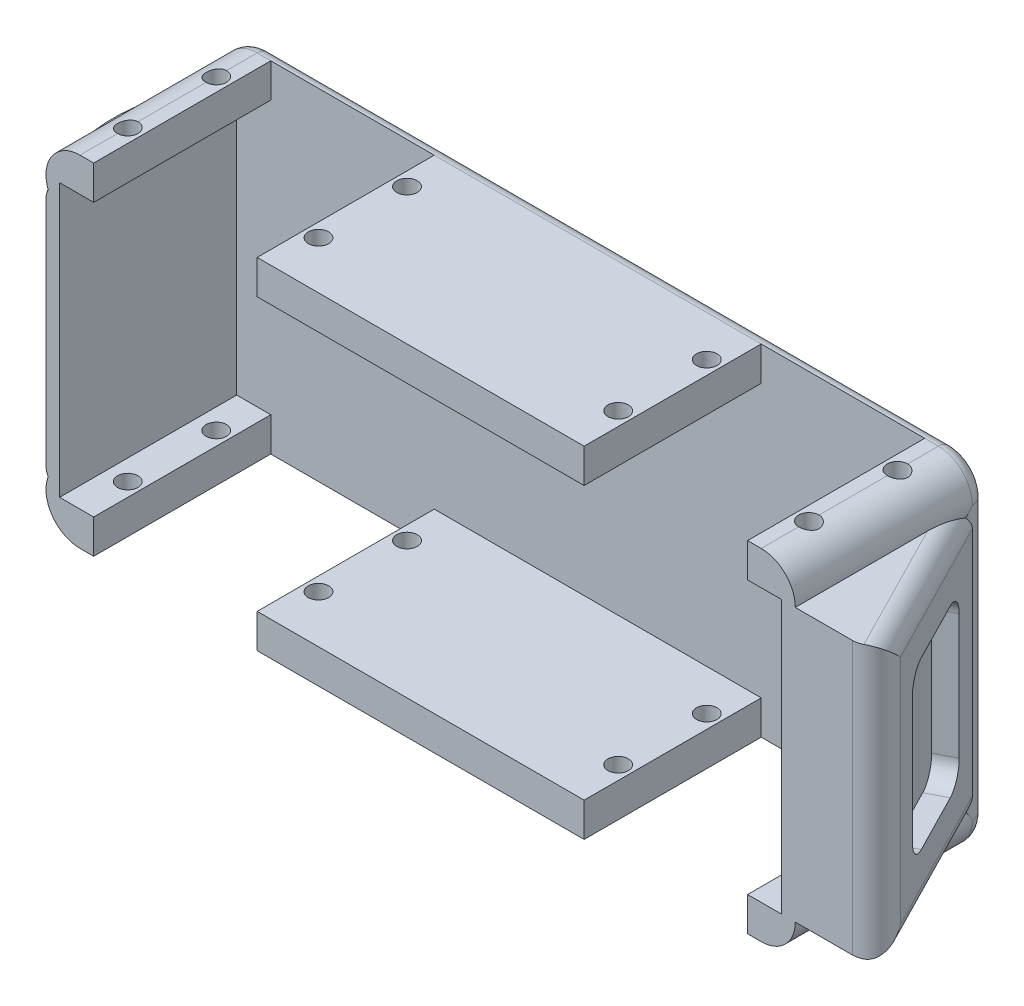
from build123d import *

# Parameters (mm, degrees)
BOSS_EXTRUDE1_DEPTH                          = 28
SKETCH2_W                                    = 106.00000000000003
SKETCH2_H                                    = 40
CUT_EXTRUDE1_DEPTH                           = 26
FILLET1_R                                    = 2
FILLET2_R                                    = 5
SKETCH3_W                                    = 23.999999999999993
SKETCH3_H                                    = 5.0000000000000036
CUT_EXTRUDE3_DEPTH                           = 26
SKETCH4_R                                    = 1.500000000000004
SKETCH4_R_2                                  = 1.5000000000000007
CUT_EXTRUDE4_DEPTH                           = 15
LPATTERN1_COUNT                              = 2
LPATTERN1_PITCH                              = 13
MIRROR4_COPY_1_SKETCH_R                      = 1.500000000000004
MIRROR4_COPY_1_SKETCH_R_2                    = 1.5000000000000007
MIRROR4_COPY_1_DEPTH                         = 15
MIRROR4_AT_THE_SECOND_PLANE_COPY_1_SKETC_R   = 1.500000000000004
MIRROR4_AT_THE_SECOND_PLANE_COPY_1_SKETC_R_2 = 1.5000000000000007
MIRROR4_AT_THE_SECOND_PLANE_COPY_1_DEPTH     = 15
MIRROR4_AT_THE_SECOND_PLANE_COPY_2_SKETC_W   = 23.999999999999993
MIRROR4_AT_THE_SECOND_PLANE_COPY_2_SKETC_H   = 5.0000000000000036
MIRROR4_AT_THE_SECOND_PLANE_COPY_2_DEPTH     = 26
MIRROR4_AT_THE_SECOND_PLANE_COPY_3_SKETC_R   = 1.500000000000004
MIRROR4_AT_THE_SECOND_PLANE_COPY_3_SKETC_R_2 = 1.5000000000000007
MIRROR4_AT_THE_SECOND_PLANE_COPY_3_DEPTH     = 15
MIRROR4_AT_THE_SECOND_PLANE_COPY_4_SKETC_R   = 1.500000000000004
MIRROR4_AT_THE_SECOND_PLANE_COPY_4_SKETC_R_2 = 1.5000000000000007
MIRROR4_AT_THE_SECOND_PLANE_COPY_4_DEPTH     = 15
BOSS_EXTRUDE2_DEPTH                          = 20
BOSS_EXTRUDE2_DEPTH_BACK                     = 20
FILLET3_R                                    = 3
FILLET4_R                                    = 3
CUT_EXTRUDE5_DEPTH                           = 3


with BuildPart() as part:
    # Sketch1 → Boss-Extrude1 (new body)
    with BuildSketch(Plane.XY):
        Polygon((-55.00000000000001, 25), (54.99999999999999, 25), (54.99999999999999, -25), (-54.99999999999999, -25), align=None)
    extrude(amount=BOSS_EXTRUDE1_DEPTH)

    # Sketch2 → Cut-Extrude1 (cut)
    with BuildSketch(Plane.XY.offset(28)):
        Rectangle(SKETCH2_W, SKETCH2_H)
    extrude(amount=-CUT_EXTRUDE1_DEPTH, mode=Mode.SUBTRACT)

    # Fillet1
    fillet1_edges = [part.edges().sort_by_distance(p)[0] for p in [
        (0, -25, 0),
        (-55, 0, 0),
        (-7.11e-15, 25, 0),
        (54.99999999999999, 0, 0),
    ]]
    fillet(fillet1_edges, radius=FILLET1_R)

    # Fillet2
    # the kernel refuses this fillet: 5 mm, written as the material it takes off along each edge
    with BuildSketch(Plane(origin=(-49.99999999999999, -20, 0), x_dir=(0, -1, 0), z_dir=(1, 0, 0))) as fillet2_piece_1:
        with BuildLine():
            CenterArc((3, -2), 2, 0, 90)
            Line((5, -2), (5, 0))
            Line((5, 0), (3, 0))
        make_face()
    revolve(axis=Axis((-49.99999999999999, -20, 0), (0, 0, -1)), revolution_arc=89.99999999999999, mode=Mode.SUBTRACT)
    with BuildSketch(Plane(origin=(-50.00000000000001, 20, 0), x_dir=(-1, -2.8e-16, 0), z_dir=(2.8e-16, -1, 0))) as fillet2_piece_2:
        with BuildLine():
            CenterArc((3, -2), 2, 0, 90)
            Line((5, -2), (5, 0))
            Line((5, 0), (3, 0))
        make_face()
    revolve(axis=Axis((-50.00000000000001, 20, 0), (0, 0, -1)), revolution_arc=90.00000000000003, mode=Mode.SUBTRACT)
    with BuildSketch(Plane(origin=(49.99999999999999, -20, 0), x_dir=(1, 0, 0), z_dir=(0, 1, 0))) as fillet2_piece_3:
        with BuildLine():
            CenterArc((3, -2), 2, 0, 90)
            Line((5, -2), (5, 0))
            Line((5, 0), (3, 0))
        make_face()
    revolve(axis=Axis((49.99999999999999, -20, 0), (0, 0, -1)), revolution_arc=90, mode=Mode.SUBTRACT)
    with BuildSketch(Plane(origin=(49.99999999999999, 20, 0), x_dir=(0, 1, 0), z_dir=(-1, 0, 0))) as fillet2_piece_4:
        with BuildLine():
            CenterArc((3, -2), 2, 0, 90)
            Line((5, -2), (5, 0))
            Line((5, 0), (3, 0))
        make_face()
    revolve(axis=Axis((49.99999999999999, 20, 0), (0, 0, -1)), revolution_arc=90, mode=Mode.SUBTRACT)
    with BuildSketch(Plane(origin=(54.99999999999999, -25, -6.7e-16), x_dir=(0, 1, 0), z_dir=(0, 0, 1)), Plane(origin=(54.99999999999999, 25, -4.4e-16), x_dir=(-1, 0, 0), z_dir=(0, 0, 1))) as fillet2_piece_5:
        with BuildLine():
            CenterArc((FILLET2_R, FILLET2_R), FILLET2_R, 180, 90)
            Line((0, FILLET2_R), (0, 0))
            Line((0, 0), (FILLET2_R, 0))
        make_face()
    extrude(amount=40.5, mode=Mode.SUBTRACT)
    with BuildSketch(Plane(origin=(-54.99999999999999, -25, -6.7e-16), x_dir=(0, 1, 0), z_dir=(0, 0, 1)), Plane(origin=(-55.00000000000001, 25, -4.4e-16), x_dir=(1, 0, 0), z_dir=(0, 0, 1))) as fillet2_piece_6:
        with BuildLine():
            CenterArc((FILLET2_R, -FILLET2_R), FILLET2_R, 90, 90)
            Line((0, -FILLET2_R), (0, 0))
            Line((0, 0), (FILLET2_R, 0))
        make_face()
    extrude(amount=40.5, mode=Mode.SUBTRACT)

    # Sketch3 → Cut-Extrude3 (cut)
    with BuildSketch(Plane.XY.offset(28)):
        with Locations((-36, 22.5)):
            Rectangle(SKETCH3_W, SKETCH3_H)
    cut_extrude3 = extrude(amount=-CUT_EXTRUDE3_DEPTH, mode=Mode.SUBTRACT)

    # Sketch4 → Cut-Extrude4 (cut)
    with BuildSketch(Plane(origin=(0, 25, 0), x_dir=(1, 0, 0), z_dir=(0, 1, 0))):
        with Locations(Location((-50, -8, 0), (0, 0, 270))):
            Circle(SKETCH4_R)
        with Locations(Location((-22.000000000000007, -7.9999999999999964, 0), (0, 0, 270))):
            Circle(SKETCH4_R_2)
    cut_extrude4 = extrude(amount=-CUT_EXTRUDE4_DEPTH, mode=Mode.SUBTRACT)

    # LPattern1: Cut-Extrude4 ×2
    with Locations(*[(0, 0, i * LPATTERN1_PITCH) for i in range(1, LPATTERN1_COUNT)]):
        add(cut_extrude4, mode=Mode.SUBTRACT)

    # Mirror4: Cut-Extrude3, Cut-Extrude4 across plane
    add(cut_extrude3.mirror(Plane(origin=(0, 0, 0), x_dir=(0, 0, 1), z_dir=(1, 0, 0))), mode=Mode.SUBTRACT)
    add(cut_extrude4.mirror(Plane(origin=(0, 0, 0), x_dir=(0, 0, 1), z_dir=(1, 0, 0))), mode=Mode.SUBTRACT)

    # Mirror4 copy 1 sketch → Mirror4 copy 1 (cut)
    with BuildSketch(Plane(origin=(0, 25, 13), x_dir=(-1, 0, 0), z_dir=(0, 1, 0))):
        with Locations((-50, 8)):
            Circle(MIRROR4_COPY_1_SKETCH_R)
        with Locations((-22.000000000000007, 7.9999999999999964)):
            Circle(MIRROR4_COPY_1_SKETCH_R_2)
    extrude(amount=-MIRROR4_COPY_1_DEPTH, mode=Mode.SUBTRACT)

    # Mirror4 at the second plane: Cut-Extrude3, Cut-Extrude4 across plane
    add(cut_extrude3.mirror(Plane.ZX), mode=Mode.SUBTRACT)
    add(cut_extrude4.mirror(Plane.ZX), mode=Mode.SUBTRACT)

    # Mirror4 at the second plane copy 1 sketc → Mirror4 at the second plane copy 1 (cut)
    with BuildSketch(Plane(origin=(0, -25, 13), x_dir=(1, 0, 0), z_dir=(0, -1, 0))):
        with Locations((-50, 8)):
            Circle(MIRROR4_AT_THE_SECOND_PLANE_COPY_1_SKETC_R)
        with Locations((-22.000000000000007, 7.9999999999999964)):
            Circle(MIRROR4_AT_THE_SECOND_PLANE_COPY_1_SKETC_R_2)
    extrude(amount=-MIRROR4_AT_THE_SECOND_PLANE_COPY_1_DEPTH, mode=Mode.SUBTRACT)

    # Mirror4 at the second plane copy 2 sketc → Mirror4 at the second plane copy 2 (cut)
    with BuildSketch(Plane(origin=(0, 0, 28), x_dir=(-1, 0, 0), z_dir=(0, 0, 1))):
        with Locations((-36, 22.5)):
            Rectangle(MIRROR4_AT_THE_SECOND_PLANE_COPY_2_SKETC_W, MIRROR4_AT_THE_SECOND_PLANE_COPY_2_SKETC_H)
    extrude(amount=-MIRROR4_AT_THE_SECOND_PLANE_COPY_2_DEPTH, mode=Mode.SUBTRACT)

    # Mirror4 at the second plane copy 3 sketc → Mirror4 at the second plane copy 3 (cut)
    with BuildSketch(Plane(origin=(0, -25, 0), x_dir=(-1, 0, 0), z_dir=(0, -1, 0))):
        with Locations(Location((-50, -8, 0), (0, 0, 270))):
            Circle(MIRROR4_AT_THE_SECOND_PLANE_COPY_3_SKETC_R)
        with Locations(Location((-22.000000000000007, -7.9999999999999964, 0), (0, 0, 270))):
            Circle(MIRROR4_AT_THE_SECOND_PLANE_COPY_3_SKETC_R_2)
    extrude(amount=-MIRROR4_AT_THE_SECOND_PLANE_COPY_3_DEPTH, mode=Mode.SUBTRACT)

    # Mirror4 at the second plane copy 4 sketc → Mirror4 at the second plane copy 4 (cut)
    with BuildSketch(Plane(origin=(0, -25, 13), x_dir=(-1, 0, 0), z_dir=(0, -1, 0))):
        with Locations(Location((-50, -8, 0), (0, 0, 270))):
            Circle(MIRROR4_AT_THE_SECOND_PLANE_COPY_4_SKETC_R)
        with Locations(Location((-22.000000000000007, -7.9999999999999964, 0), (0, 0, 270))):
            Circle(MIRROR4_AT_THE_SECOND_PLANE_COPY_4_SKETC_R_2)
    extrude(amount=-MIRROR4_AT_THE_SECOND_PLANE_COPY_4_DEPTH, mode=Mode.SUBTRACT)

    # Sketch5 → Boss-Extrude2 (add, two sides: drawn at the far end of the back side and taken through both)
    with BuildSketch(Plane(origin=(0, 0, 0), x_dir=(1, 0, 0), z_dir=(0, 1, 0)).offset(-BOSS_EXTRUDE2_DEPTH_BACK)):
        Polygon((54.99999999999999, -1.9999999999999982), (68.27804634105689, -28), (54.99999999999999, -28), align=None)
        with BuildLine():
            Line((-55.00000000000001, -1.9999999999999982), (-55.00000000000001, -28))
            ThreePointArc((-55.00000000000001, -28), (-59.03952483504219, -14.999999999999996), (-55.00000000000001, -1.9999999999999982))
        make_face()
    extrude(amount=BOSS_EXTRUDE2_DEPTH + BOSS_EXTRUDE2_DEPTH_BACK)

    # Fillet3
    # the kernel refuses this fillet: 3 mm, written as the material it takes off along each edge
    with BuildSketch(Plane(origin=(-36.1014605254329, -20, 15), x_dir=(-0.5981604498568248, 0, 0.8013763636563541), z_dir=(0.8013763636563541, 0, 0.5981604498568248))) as fillet3_piece_1_section:
        with BuildLine():
            CenterArc((22.93806430960929 - FILLET3_R, -FILLET3_R), FILLET3_R, 0, 90)
            Line((22.93806430960929 - FILLET3_R, 0), (22.93806430960929, 0))
            Line((22.93806430960929, 0), (22.93806430960929, -FILLET3_R))
        make_face()
    fillet3_piece_1 = revolve(axis=Axis((-36.1014605254329, -20, 15), (0, -1, 0)), revolution_arc=106.52347426926733, mode=Mode.PRIVATE)
    fillet3_piece_1 = fillet3_piece_1 - Plane(origin=(-50, -20, 15.08905833687256), x_dir=(0, 1, 0), z_dir=(0, 0, -1)) * Cylinder(5, 92, mode=Mode.PRIVATE)
    fillet3_piece_1 = fillet3_piece_1 - Plane(origin=(-53, -19.147031230500815, 1.9999999999999996), x_dir=(-1, -2.8e-16, 0), z_dir=(-2.8e-16, 1, 0)) * Cylinder(2, 92, mode=Mode.PRIVATE)
    add(fillet3_piece_1, mode=Mode.SUBTRACT)
    with BuildSketch(Plane(origin=(-36.1014605254329, 20, 15), x_dir=(-0.5981604498568248, 0, 0.8013763636563541), z_dir=(0.8013763636563541, 0, 0.5981604498568248))) as fillet3_piece_2_section:
        with BuildLine():
            CenterArc((22.93806430960929 - FILLET3_R, FILLET3_R), FILLET3_R, 270, 90)
            Line((22.93806430960929 - FILLET3_R, 0), (22.93806430960929, 0))
            Line((22.93806430960929, 0), (22.93806430960929, FILLET3_R))
        make_face()
    fillet3_piece_2 = revolve(axis=Axis((-36.1014605254329, 20, 15), (0, -1, 0)), revolution_arc=106.52347426926733, mode=Mode.PRIVATE)
    fillet3_piece_2 = fillet3_piece_2 - Plane(origin=(-50, 20, 15.08905833686733), x_dir=(1, 0, 0), z_dir=(0, 0, -1)) * Cylinder(5, 92, mode=Mode.PRIVATE)
    fillet3_piece_2 = fillet3_piece_2 - Plane(origin=(-53.000000000000014, 19.147031229108137, 1.9999999999999996), x_dir=(-1, -2.8e-16, 0), z_dir=(-2.8e-16, 1, 0)) * Cylinder(2, 92, mode=Mode.PRIVATE)
    add(fillet3_piece_2, mode=Mode.SUBTRACT)

    # Fillet4
    # the kernel refuses this fillet: 3 mm, written as the material it takes off along each edge
    with BuildSketch(Plane(origin=(51.58887574553635, -20, -4.6793885439170175), x_dir=(-0.8905851391889352, 0, 0.45481656726181896), z_dir=(0.45481656726181896, 0, 0.8905851391889353))) as fillet4_piece_1_section:
        with BuildLine():
            CenterArc((FILLET4_R, -FILLET4_R), FILLET4_R, 90, 90)
            Line((2.83e-15, -FILLET4_R), (0, 0))
            Line((0, 0), (FILLET4_R, 0))
        make_face()
    fillet4_piece_1 = extrude(amount=44.194289075695174, mode=Mode.PRIVATE)
    fillet4_piece_1 = fillet4_piece_1 - Plane(origin=(50, -20, 15.678457101649087), x_dir=(0, 1, 0), z_dir=(0, 0, -1)) * Cylinder(5, 101, mode=Mode.PRIVATE)
    fillet4_piece_1 = fillet4_piece_1 - Plane(origin=(52.99999999999999, -19.312649305850513, 1.9999999999999996), x_dir=(1, 0, 0), z_dir=(0, -1, 0)) * Cylinder(2, 101, mode=Mode.PRIVATE)
    add(fillet4_piece_1, mode=Mode.SUBTRACT)
    with BuildSketch(Plane(origin=(68.27804634105689, 32.2516352163708, 28), x_dir=(-1, 0, 0), z_dir=(0, -1, 0))) as fillet4_piece_2:
        with BuildLine():
            CenterArc((FILLET4_R * 1.63355136218, FILLET4_R), FILLET4_R, 152.9468675340144, 117.05313246598561)
            Line((FILLET4_R * 0.742966222994, FILLET4_R * 1.45481656726), (0, 0))
            Line((0, 0), (FILLET4_R * 1.63355136218, 0))
        make_face()
    extrude(amount=64.5032704327416, mode=Mode.SUBTRACT)
    with BuildSketch(Plane(origin=(51.58887574553635, 20, -4.679388543917019), x_dir=(-4.8e-16, -1, 2.4e-16), z_dir=(0.45481656726181896, 0, 0.8905851391889353))) as fillet4_piece_3_section:
        with BuildLine():
            CenterArc((FILLET4_R, -FILLET4_R), FILLET4_R, 90.00000000000004, 90)
            Line((1.62e-15, -FILLET4_R), (0, 0))
            Line((0, 0), (FILLET4_R, 0))
        make_face()
    fillet4_piece_3 = extrude(amount=44.194289075695174, mode=Mode.PRIVATE)
    fillet4_piece_3 = fillet4_piece_3 - Plane(origin=(52.99999999999999, 19.312649295063746, 1.9999999999999996), x_dir=(1, 0, 0), z_dir=(0, -1, 0)) * Cylinder(2, 101, mode=Mode.PRIVATE)
    fillet4_piece_3 = fillet4_piece_3 - Plane(origin=(50, 20, 15.67845699140253), x_dir=(-1, 0, 0), z_dir=(0, 0, -1)) * Cylinder(5, 101, mode=Mode.PRIVATE)
    add(fillet4_piece_3, mode=Mode.SUBTRACT)

    # Sketch6 → Cut-Extrude5 (cut)
    with BuildSketch(Plane(origin=(42.81269820620907, 0, -21.86419195260489), x_dir=(-0.45481656726181885, 0, -0.8905851391889354), z_dir=(0.8905851391889354, 0, -0.45481656726181885))):
        with BuildLine():
            Line((-44.028294567880685, 12.191750605269407), (-34.243805861609616, 12.191750605269407))
            ThreePointArc((-34.243805861609616, 12.191750605269407), (-32.12248551804998, 11.31307094882905), (-31.24380586160961, 9.191750605269409))
            Line((-31.24380586160961, 9.191750605269409), (-31.24380586160961, -9.191750605269409))
            ThreePointArc((-31.24380586160961, -9.191750605269409), (-32.12248551804997, -11.313070948829052), (-34.243805861609616, -12.19175060526941))
            Line((-34.243805861609616, -12.19175060526941), (-44.028294567880685, -12.19175060526941))
            ThreePointArc((-44.028294567880685, -12.19175060526941), (-46.149614911440324, -11.313070948829047), (-47.02829456788068, -9.191750605269409))
            Line((-47.02829456788068, -9.191750605269409), (-47.02829456788068, 9.191750605269409))
            ThreePointArc((-47.02829456788068, 9.191750605269409), (-46.149614911440324, 11.31307094882905), (-44.028294567880685, 12.191750605269407))
        make_face()
    extrude(amount=-CUT_EXTRUDE5_DEPTH, mode=Mode.SUBTRACT)


solid = part.part
